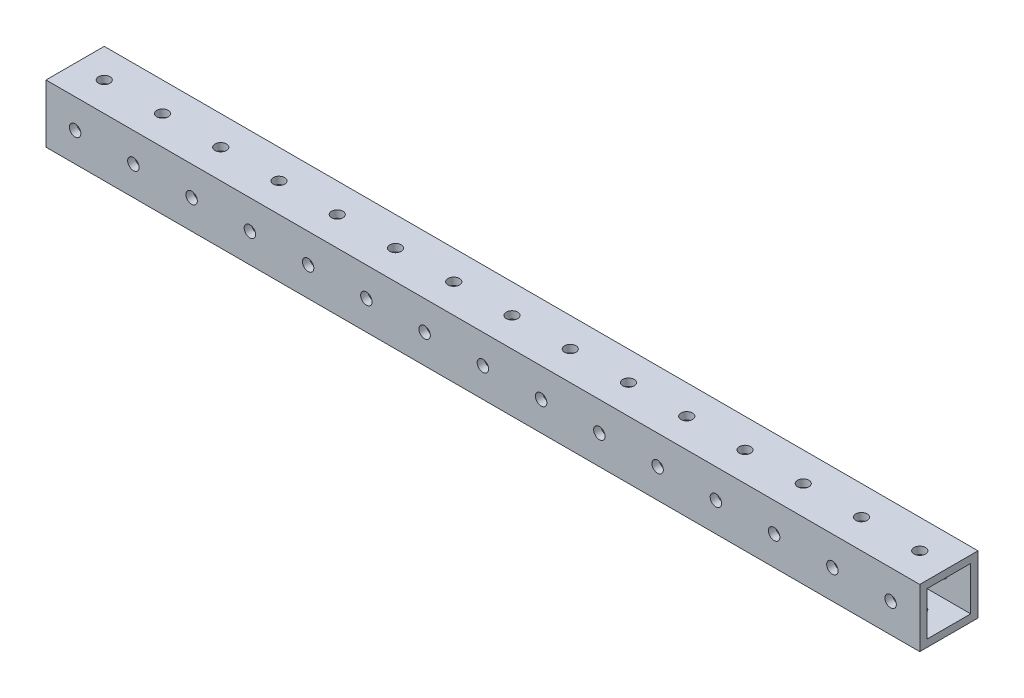
from build123d import *

# Parameters (mm, degrees)
SKETCH1_W             = 25.4
SKETCH1_H             = 25.4
SKETCH1_W_2           = 19.05
SKETCH1_H_2           = 19.05
BOSS_EXTRUDE1_DEPTH   = 190.5
SKETCH3_W             = 2.4892
SKETCH3_H             = 25.4
SKETCH3_AT_POINT_2_W  = 2.4892
SKETCH3_AT_POINT_2_H  = 25.4
LPATTERN1_START       = -12.7
LPATTERN1_OUTLINE_R   = 2.4892
LPATTERN1_DEPTH       = 25.4
LPATTERN1_2_OUTLINE_R = 2.4892
LPATTERN1_2_DEPTH     = 25.4


# Read off the part's stored shape, not the designer's step: LPattern1
with BuildPart() as part:
    # Sketch1 → Boss-Extrude1 (new, symmetric)
    with BuildSketch(Plane(origin=(0, 0, 0), x_dir=(0, 0, -1), z_dir=(1, 0, 0))):
        Rectangle(SKETCH1_W, SKETCH1_H)
        Rectangle(SKETCH1_W_2, SKETCH1_H_2, mode=Mode.SUBTRACT)
    extrude(amount=BOSS_EXTRUDE1_DEPTH, both=True)

    # Sketch3 → #9 (0.196) Diameter Hole1 (revolve, cut)
    with BuildSketch(Plane(origin=(177.8, 12.7, 0), x_dir=(0, 0, 1), z_dir=(1, 0, 0))):
        with Locations((1.2446, 12.7)):
            Rectangle(SKETCH3_W, SKETCH3_H)
    revolve(axis=Axis((177.8, 19.05, 0), (0, -1, 0)), mode=Mode.SUBTRACT)

    # Sketch3 at point 2 (carried to point 2, square into its face) → #9 (0.196) Diameter Hole1 at 2 (revolve, cut)
    with BuildSketch(Plane(origin=(177.8, 0, 12.7), x_dir=(0, -1, 0), z_dir=(1, 0, 0))):
        with Locations((1.2446, 12.7)):
            Rectangle(SKETCH3_AT_POINT_2_W, SKETCH3_AT_POINT_2_H)
    revolve(axis=Axis((177.8, 0, 19.05), (0, 0, -1)), mode=Mode.SUBTRACT)

    # LPattern1 outline → LPattern1 (cut)
    with BuildSketch(Plane.XY.offset(LPATTERN1_START)):
        with Locations((152.4, 0)):
            Circle(LPATTERN1_OUTLINE_R)
        with Locations((127, 0)):
            Circle(LPATTERN1_OUTLINE_R)
        with Locations((101.6, 0)):
            Circle(LPATTERN1_OUTLINE_R)
        with Locations((76.2, 0)):
            Circle(LPATTERN1_OUTLINE_R)
        with Locations((50.8, 0)):
            Circle(LPATTERN1_OUTLINE_R)
        with Locations((25.4, 0)):
            Circle(LPATTERN1_OUTLINE_R)
        Circle(LPATTERN1_OUTLINE_R)
        with Locations((-25.4, 0)):
            Circle(LPATTERN1_OUTLINE_R)
        with Locations((-50.8, 0)):
            Circle(LPATTERN1_OUTLINE_R)
        with Locations((-76.2, 0)):
            Circle(LPATTERN1_OUTLINE_R)
        with Locations((-101.6, 0)):
            Circle(LPATTERN1_OUTLINE_R)
        with Locations((-127, 0)):
            Circle(LPATTERN1_OUTLINE_R)
        with Locations((-152.4, 0)):
            Circle(LPATTERN1_OUTLINE_R)
        with Locations((-177.8, 0)):
            Circle(LPATTERN1_OUTLINE_R)
    extrude(amount=LPATTERN1_DEPTH, mode=Mode.SUBTRACT)

    # LPattern1 2 outline → LPattern1 2 (cut)
    with BuildSketch(Plane(origin=(0, 0, 0), x_dir=(1, 0, 0), z_dir=(0, 1, 0)).offset(LPATTERN1_START)):
        with Locations((152.4, 0)):
            Circle(LPATTERN1_2_OUTLINE_R)
        with Locations((127, 0)):
            Circle(LPATTERN1_2_OUTLINE_R)
        with Locations((101.6, 0)):
            Circle(LPATTERN1_2_OUTLINE_R)
        with Locations((76.2, 0)):
            Circle(LPATTERN1_2_OUTLINE_R)
        with Locations((50.8, 0)):
            Circle(LPATTERN1_2_OUTLINE_R)
        with Locations((25.4, 0)):
            Circle(LPATTERN1_2_OUTLINE_R)
        Circle(LPATTERN1_2_OUTLINE_R)
        with Locations((-25.4, 0)):
            Circle(LPATTERN1_2_OUTLINE_R)
        with Locations((-50.8, 0)):
            Circle(LPATTERN1_2_OUTLINE_R)
        with Locations((-76.2, 0)):
            Circle(LPATTERN1_2_OUTLINE_R)
        with Locations((-101.6, 0)):
            Circle(LPATTERN1_2_OUTLINE_R)
        with Locations((-127, 0)):
            Circle(LPATTERN1_2_OUTLINE_R)
        with Locations((-152.4, 0)):
            Circle(LPATTERN1_2_OUTLINE_R)
        with Locations((-177.8, 0)):
            Circle(LPATTERN1_2_OUTLINE_R)
    extrude(amount=LPATTERN1_2_DEPTH, mode=Mode.SUBTRACT)


solid = part.part
